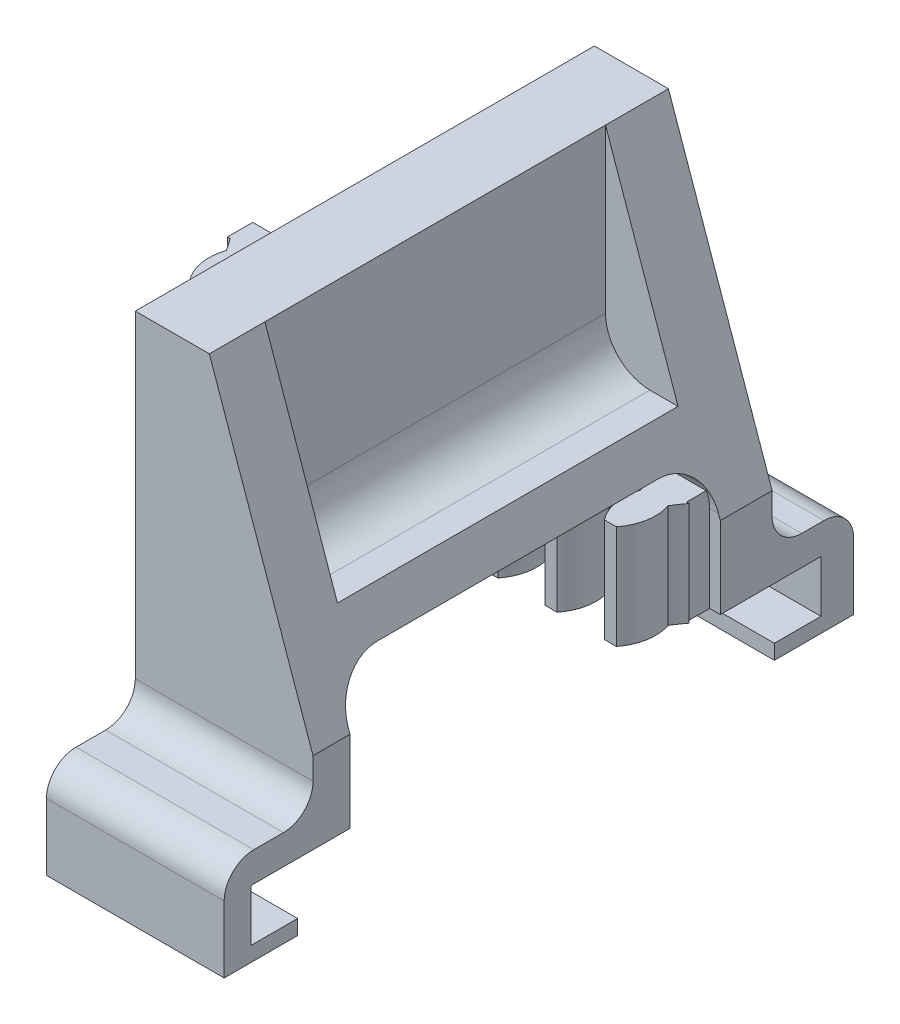
from build123d import *

# Parameters (mm, degrees)
BOSS_EXTRUDE1_DEPTH = 31
SKETCH4_W           = 25
SKETCH4_H           = 15
CUT_EXTRUDE2_DEPTH  = 25
CUT_EXTRUDE4_DEPTH  = 11.5
SKETCH7_W           = 31
SKETCH7_H           = 1.7
BOSS_EXTRUDE3_DEPTH = 7
BOSS_EXTRUDE4_DEPTH = 7
LPATTERN1_COUNT     = 8
LPATTERN1_PITCH     = 4
SKETCH11_W          = 12
SKETCH11_H          = 6.5
BOSS_EXTRUDE5_DEPTH = 5.5
FILLET5_R           = 3
SKETCH12_W          = 12
SKETCH12_H          = 6.5
BOSS_EXTRUDE6_DEPTH = 6
CUT_EXTRUDE5_DEPTH  = 12
FILLET6_R           = 2


with BuildPart() as part:
    # Sketch1 → Boss-Extrude1 (new body)
    with BuildSketch(Plane.XY):
        Polygon((0, 0), (0, -30), (12, -30), (12, -20), (5, 0), align=None)
    extrude(amount=-BOSS_EXTRUDE1_DEPTH)

    # Sketch4 → Cut-Extrude2 (cut)
    with BuildSketch(Plane.ZY):
        with Locations((-15, -24.143402944)):
            Rectangle(SKETCH4_W, SKETCH4_H)
    extrude(amount=-CUT_EXTRUDE2_DEPTH, mode=Mode.SUBTRACT)

    # Sketch6 → Cut-Extrude4 (cut, symmetric)
    with BuildSketch(Plane.XY.offset(-15.25)):
        Polygon((5, 0), (5, -14), (9.9, -14), align=None)
    extrude(amount=CUT_EXTRUDE4_DEPTH, both=True, mode=Mode.SUBTRACT)

    # Sketch7 → Boss-Extrude3 (add)
    with BuildSketch(Plane(origin=(0, -25.5, 0), x_dir=(1, 0, 0), z_dir=(0, 1, 0))):
        with Locations((-4.2231607, 26.8)):
            Rectangle(SKETCH7_W, SKETCH7_H)
    extrude(amount=BOSS_EXTRUDE3_DEPTH)

    # Sketch10 → Boss-Extrude4 (add)
    with BuildSketch(Plane(origin=(0, -25.5, 0), x_dir=(1, 0, 0), z_dir=(0, 1, 0))):
        with BuildLine():
            Line((10.353586314, 22.126900466), (9.550714712, 22.126900466))
            ThreePointArc((9.550714712, 22.126900466), (8.911730102, 23.551984668), (9.029666421, 25.109308443))
            ThreePointArc((9.029666421, 25.109308443), (8.752067329, 25.53731984), (8.452150513, 25.95))
            Line((8.452150513, 25.95), (11.452150513, 25.95))
            ThreePointArc((11.452150513, 25.95), (11.152233697, 25.53731984), (10.874634605, 25.109308443))
            ThreePointArc((10.874634605, 25.109308443), (10.992570924, 23.551984668), (10.353586314, 22.126900466))
        make_face()
    boss_extrude4 = extrude(amount=BOSS_EXTRUDE4_DEPTH)

    # LPattern1: Boss-Extrude4 ×8
    with Locations(*[(-i * LPATTERN1_PITCH, 0, 0) for i in range(1, LPATTERN1_COUNT)]):
        add(boss_extrude4)

    # Sketch11 → Boss-Extrude5 (add)
    with BuildSketch(Plane(origin=(0, 0, -31), x_dir=(-1, 0, 0), z_dir=(0, 0, -1))):
        with Locations((-6, -26.75)):
            Rectangle(SKETCH11_W, SKETCH11_H)
    extrude(amount=BOSS_EXTRUDE5_DEPTH)

    # Fillet5
    # the kernel refuses this fillet: 3 mm, written as the material it adds along each edge
    with BuildSketch(Plane(origin=(5, -14, -34.25), x_dir=(0, 1, 0), z_dir=(0, 0, 1))) as fillet5_piece_1_section:
        with BuildLine():
            CenterArc((FILLET5_R, -FILLET5_R), FILLET5_R, 90, 90)
            Line((0, -FILLET5_R), (0, 0))
            Line((0, 0), (FILLET5_R, 0))
        make_face()
    fillet5_piece_1 = extrude(amount=38, mode=Mode.PRIVATE)
    fillet5_piece_1 = split(fillet5_piece_1, bisect_by=Plane(origin=(5.670103817, -13.329896183, -31), z_dir=(0, 0, 1)), keep=Keep.TOP, mode=Mode.PRIVATE)
    fillet5_piece_1 = split(fillet5_piece_1, bisect_by=Plane(origin=(5.670103817, -13.329896183, 0), z_dir=(0, 0, -1)), keep=Keep.TOP, mode=Mode.PRIVATE)
    add(fillet5_piece_1)
    with BuildSketch(Plane(origin=(0, -16.643402944, -2.5), x_dir=(0, -1, 0), z_dir=(1, 0, 0))) as fillet5_piece_2_section:
        with BuildLine():
            CenterArc((FILLET5_R, FILLET5_R), FILLET5_R, 180, 90)
            Line((0, FILLET5_R), (0, 0))
            Line((0, 0), (FILLET5_R, 0))
        make_face()
    fillet5_piece_2 = extrude(amount=18.32519103, mode=Mode.PRIVATE)
    fillet5_piece_2 = split(fillet5_piece_2, bisect_by=Plane(origin=(10.459559167, -15.598740478, -3.164212855), z_dir=(-0.9438583563660173, -0.33035042472810633, 0)), keep=Keep.TOP, mode=Mode.PRIVATE)
    add(fillet5_piece_2)
    with BuildSketch(Plane(origin=(0, -16.643402944, -27.5), x_dir=(0, 0, 1), z_dir=(1, 0, 0))) as fillet5_piece_3_section:
        with BuildLine():
            CenterArc((FILLET5_R, FILLET5_R), FILLET5_R, 180, 90)
            Line((0, FILLET5_R), (0, 0))
            Line((0, 0), (FILLET5_R, 0))
        make_face()
    fillet5_piece_3 = extrude(amount=18.32519103, mode=Mode.PRIVATE)
    fillet5_piece_3 = split(fillet5_piece_3, bisect_by=Plane(origin=(10.435387917, -15.529679764, -26.806522223), z_dir=(-0.9438583563660173, -0.33035042472810633, 0)), keep=Keep.TOP, mode=Mode.PRIVATE)
    add(fillet5_piece_3)

    # Sketch12 → Boss-Extrude6 (add)
    with BuildSketch(Plane.XY):
        with Locations((6, -26.75)):
            Rectangle(SKETCH12_W, SKETCH12_H)
    extrude(amount=BOSS_EXTRUDE6_DEPTH)

    # Sketch13 → Cut-Extrude5 (cut)
    with BuildSketch(Plane.ZY):
        Polygon((-34.3, -25.5), (-27.5, -25.5), (-27.5, -32.069121633), (-31.15, -32.069121633), (-31.15, -29), (-34.3, -29), align=None)
        Polygon((1.037837299, -29), (4.187837299, -29), (4.187837299, -25.5), (-2.612162701, -25.5), (-2.612162701, -32.069121633), (1.037837299, -32.069121633), align=None)
    extrude(amount=-CUT_EXTRUDE5_DEPTH, mode=Mode.SUBTRACT)

    # Fillet6
    fillet6_edges = [part.edges().sort_by_distance(p)[0] for p in [
        (6, -23.5, -31),
        (6, -23.5, -36.5),
        (6, -23.5, 0),
        (6, -23.5, 6),
    ]]
    fillet(fillet6_edges, radius=FILLET6_R)


solid = part.part
